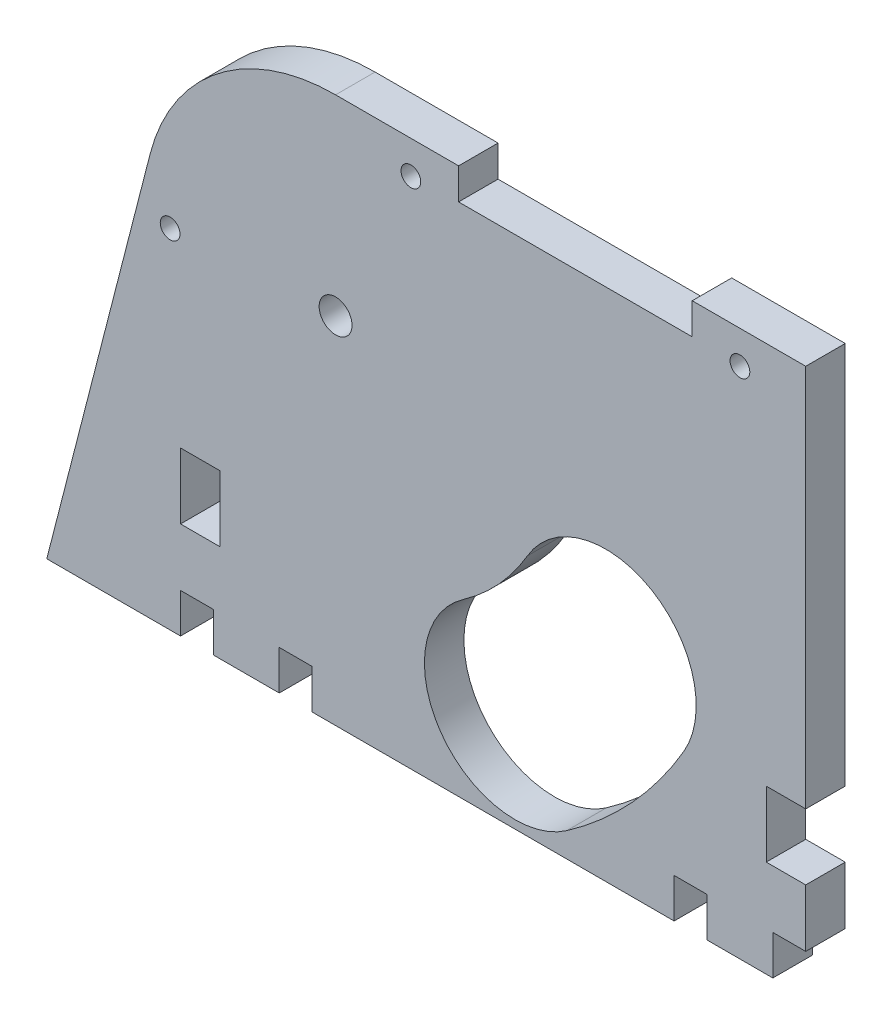
from build123d import *

# Parameters (mm, degrees)
SKETCH1_R           = 2.5
BOSS_EXTRUDE1_DEPTH = 6
SKETCH2_W           = 5
SKETCH2_H           = 6
SKETCH2_W_2         = 6
SKETCH2_H_2         = 10
CUT_EXTRUDE1_DEPTH  = 134.97761007
SKETCH3_R           = 1.5
CUT_EXTRUDE2_DEPTH  = 134.97761007
SKETCH4_W           = 35.5
SKETCH4_H           = 4.75
CUT_EXTRUDE3_DEPTH  = 10
CAVITY1_OUTLINE_R   = 1.5
CAVITY1_DEPTH       = 6
CUT_EXTRUDE4_DEPTH  = 134.97761007


# Read off the part's stored shape, not the designer's step: Cavity1
with BuildPart() as part:
    # Sketch1 → Boss-Extrude1 (new body)
    with BuildSketch(Plane.XY):
        with BuildLine():
            Line((-9.685424338, 2.488484559), (5.386220056, 61.148792841))
            ThreePointArc((5.386220056, 61.148792841), (15.733633721, 76.897010412), (33.561388608, 83))
            Line((33.561388608, 83), (105, 83))
            Line((105, 83), (105, 0))
            Line((105, 0), (-10.324792855, 0))
            Line((-10.324792855, 0), (-9.685424338, 2.488484559))
        make_face()
        with Locations((33.561388608, 53.909722104)):
            Circle(SKETCH1_R, mode=Mode.SUBTRACT)
        with BuildLine():
            ThreePointArc((67.975974789, 4.760599446), (77.719162031, 13.288409394), (85.405906554, 23.707967867))
            ThreePointArc((85.405906554, 23.707967867), (80.896997447, 40.800941239), (63.804024076, 36.292032133))
            ThreePointArc((63.804024076, 36.292032133), (59.320089771, 30.213956356), (53.63656388, 25.239400554))
            ThreePointArc((53.63656388, 25.239400554), (50.566868781, 7.830294546), (67.975974789, 4.760599446))
        make_face(mode=Mode.SUBTRACT)
    extrude(amount=BOSS_EXTRUDE1_DEPTH)

    # Sketch2 → Cut-Extrude1 (cut, through all)
    with BuildSketch(Plane.XY.offset(6)):
        with Locations((12.5, 3)):
            Rectangle(SKETCH2_W, SKETCH2_H)
        with Locations((102.5, 3)):
            Rectangle(SKETCH2_W, SKETCH2_H)
        with Locations((27.5, 3)):
            Rectangle(SKETCH2_W, SKETCH2_H)
        with Locations((87.5, 3)):
            Rectangle(SKETCH2_W, SKETCH2_H)
        with Locations((102, 19.75)):
            Rectangle(SKETCH2_W_2, SKETCH2_H_2)
        with Locations((13, 19.75)):
            Rectangle(SKETCH2_W_2, SKETCH2_H_2)
    extrude(amount=-CUT_EXTRUDE1_DEPTH, mode=Mode.SUBTRACT)

    # Sketch3 → Cut-Extrude2 (cut, through all)
    with BuildSketch(Plane.XY.offset(6)):
        with Locations((95, 78)):
            Circle(SKETCH3_R)
        with Locations((45, 78)):
            Circle(SKETCH3_R)
    extrude(amount=-CUT_EXTRUDE2_DEPTH, mode=Mode.SUBTRACT)

    # Sketch4 → Cut-Extrude3 (cut)
    with BuildSketch(Plane.XY.offset(6)):
        with Locations((70, 80.625)):
            Rectangle(SKETCH4_W, SKETCH4_H)
    extrude(amount=-CUT_EXTRUDE3_DEPTH, mode=Mode.SUBTRACT)

    # Cavity1 outline → Cavity1 (cut)
    with BuildSketch(Plane.XY):
        with Locations((8.414860226, 52.844005614)):
            Circle(CAVITY1_OUTLINE_R)
    extrude(amount=CAVITY1_DEPTH, mode=Mode.SUBTRACT)

    # Sketch5 → Cut-Extrude4 (cut, through all)
    with BuildSketch(Plane.XY.offset(6)):
        with BuildLine():
            ThreePointArc((52.919593335, 26.263340609), (49.542928725, 7.113324), (68.692945334, 3.736659391))
            ThreePointArc((68.692945334, 3.736659391), (78.639115644, 12.442132046), (86.486000678, 23.078764654))
            ThreePointArc((86.486000678, 23.078764654), (81.526200661, 41.881035363), (62.723929952, 36.921235346))
            ThreePointArc((62.723929952, 36.921235346), (58.400136158, 31.060233704), (52.919593335, 26.263340609))
        make_face()
    extrude(amount=-CUT_EXTRUDE4_DEPTH, mode=Mode.SUBTRACT)


solid = part.part
